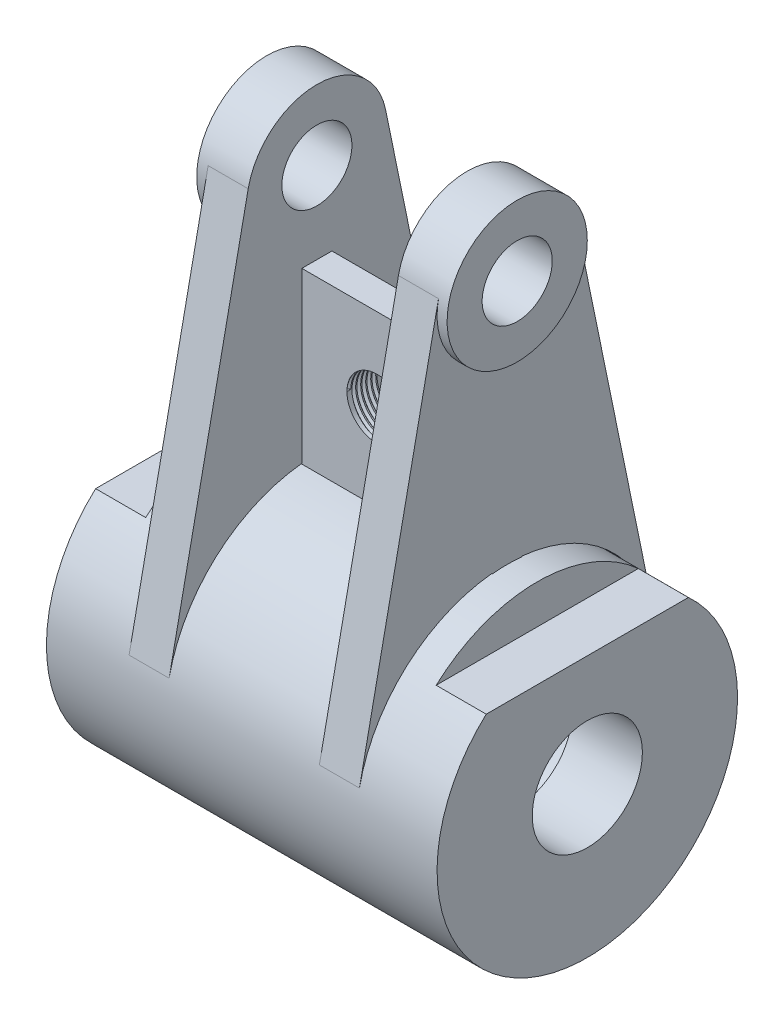
from build123d import *

# Parameters (mm, degrees)
SKETCH1_R               = 30
BOSS_EXTRUDE1_DEPTH     = 39
CUT_EXTRUDE1_DEPTH      = 10
SKETCH3_R               = 18
CUT_EXTRUDE2_DEPTH      = 25
SKETCH4_R               = 11
CUT_EXTRUDE3_DEPTH      = 94
BOSS_EXTRUDE2_START     = -10
BOSS_EXTRUDE2_OUTLINE_R = 7
BOSS_EXTRUDE2_DEPTH     = 10
CUT_EXTRUDE4_DEPTH      = 2
SKETCH6_3_W             = 6
SKETCH6_3_H             = 37.494857384
BOSS_EXTRUDE3_DEPTH     = 32
SKETCH8_R               = 6
CUT_EXTRUDE5_DEPTH      = 41.5
SKETCH16_R              = 8
CUT_EXTRUDE6_DEPTH      = 83
THREAD2_PITCH           = 1


# Read off the part's stored shape, not the designer's step: Boss-Extrude2
with BuildPart() as part:
    # Sketch1 → Boss-Extrude1 (new, symmetric)
    with BuildSketch(Plane(origin=(0, 0, 0), x_dir=(0, 0, -1), z_dir=(1, 0, 0))):
        Circle(SKETCH1_R)
    extrude(amount=BOSS_EXTRUDE1_DEPTH, both=True)

    # Sketch2 → Cut-Extrude1 (cut)
    with BuildSketch(Plane(origin=(39, 0, 0), x_dir=(0, 0, -1), z_dir=(1, 0, 0))):
        with BuildLine():
            Line((-20.182341534, 22.196240452), (0, 22.196240452))
            Line((0, 22.196240452), (20.182341534, 22.196240452))
            ThreePointArc((20.182341534, 22.196240452), (0, 30), (-20.182341534, 22.196240452))
        make_face()
    cut_extrude1 = extrude(amount=-CUT_EXTRUDE1_DEPTH, mode=Mode.SUBTRACT)

    # Mirror2: Cut-Extrude1 across plane
    add(cut_extrude1.mirror(Plane(origin=(0, 0, 0), x_dir=(0, 0, 1), z_dir=(1, 0, 0))), mode=Mode.SUBTRACT)

    # Sketch3 → Cut-Extrude2 (cut, symmetric)
    with BuildSketch(Plane(origin=(0, 0, 0), x_dir=(0, 0, -1), z_dir=(1, 0, 0))):
        Circle(SKETCH3_R)
    extrude(amount=CUT_EXTRUDE2_DEPTH, both=True, mode=Mode.SUBTRACT)

    # Sketch4 → Cut-Extrude3 (cut, symmetric)
    with BuildSketch(Plane(origin=(39, 0, 0), x_dir=(0, 0, -1), z_dir=(1, 0, 0))):
        Circle(SKETCH4_R)
    extrude(amount=CUT_EXTRUDE3_DEPTH, both=True, mode=Mode.SUBTRACT)

    # Boss-Extrude2 outline → Boss-Extrude2 (add)
    with BuildSketch(Plane(origin=(-15, 0, 0), x_dir=(0, 0, -1), z_dir=(1, 0, 0)).offset(BOSS_EXTRUDE2_START)):
        with BuildLine():
            Line((3, 29.849623113), (3, 29.968207601))
            ThreePointArc((3, 29.968207601), (20.171104868, 22.365598476), (29.500383119, 6.068019663))
            Line((29.500383119, 6.068019663), (13.712911473, 82.820648672))
            ThreePointArc((13.712911473, 82.820648672), (0, 94), (-13.712911473, 82.820648672))
            Line((-13.712911473, 82.820648672), (-29.500383119, 6.068019663))
            ThreePointArc((-29.500383119, 6.068019663), (-20.171104868, 22.365598476), (-3, 29.968207601))
            Line((-3, 29.968207601), (-3, 29.849623113))
            ThreePointArc((-3, 29.849623113), (0, 30), (3, 29.849623113))
        make_face()
        with Locations((0, 80)):
            Circle(BOSS_EXTRUDE2_OUTLINE_R, mode=Mode.SUBTRACT)
    boss_extrude2 = extrude(amount=BOSS_EXTRUDE2_DEPTH)

    # Sketch7 → Cut-Extrude4 (cut)
    with BuildSketch(Plane.ZY.offset(25)):
        with BuildLine():
            ThreePointArc((-29.500383119, 6.068019663), (-20.171104868, 22.365598476), (-3, 29.968207601))
            Line((-3, 29.968207601), (-3, 29.849623113))
            ThreePointArc((-3, 29.849623113), (0, 30), (3, 29.849623113))
            Line((3, 29.849623113), (3, 29.968207601))
            ThreePointArc((3, 29.968207601), (20.171104868, 22.365598476), (29.500383119, 6.068019663))
            Line((29.500383119, 6.068019663), (13.712911473, 82.820648672))
            ThreePointArc((13.712911473, 82.820648672), (13.928042946, 81.417610556), (14, 80))
            ThreePointArc((14, 80), (-1.417610556, 66.071957054), (-13.712911473, 82.820648672))
            Line((-13.712911473, 82.820648672), (-29.500383119, 6.068019663))
        make_face()
    cut_extrude4 = extrude(amount=-CUT_EXTRUDE4_DEPTH, mode=Mode.SUBTRACT)

    # Mirror3: Boss-Extrude2, Cut-Extrude4 across plane
    add(boss_extrude2.mirror(Plane(origin=(0, 0, 0), x_dir=(0, 0, 1), z_dir=(1, 0, 0))))
    add(cut_extrude4.mirror(Plane(origin=(0, 0, 0), x_dir=(0, 0, 1), z_dir=(1, 0, 0))), mode=Mode.SUBTRACT)

    # Sketch6<3> → Boss-Extrude3 (add)
    with BuildSketch(Plane(origin=(-15, 0, 0), x_dir=(0, 0, -1), z_dir=(1, 0, 0))):
        with Locations((0, 44.952571308)):
            Rectangle(SKETCH6_3_W, SKETCH6_3_H)
    extrude(amount=BOSS_EXTRUDE3_DEPTH)

    # Sketch8 → Cut-Extrude5 (cut, symmetric)
    with BuildSketch(Plane(origin=(0, 0, -3), x_dir=(-1, 0, 0), z_dir=(0, 0, -1))):
        with Locations(Location((0, 46.89944487, 0), (0, 0, 180))):
            Circle(SKETCH8_R)
    extrude(amount=CUT_EXTRUDE5_DEPTH, both=True, mode=Mode.SUBTRACT)

    # Sketch16 → Cut-Extrude6 (cut)
    with BuildSketch(Plane(origin=(0, 0, 0), x_dir=(1, 0, 0), z_dir=(0, 1, 0))):
        with Locations(Location((0, 0, 0), (0, 0, 270))):
            Circle(SKETCH16_R)
    extrude(amount=-CUT_EXTRUDE6_DEPTH, mode=Mode.SUBTRACT)

    # Thread2: the profile of Thread Profile2 profile screwed along a right-hand helix of 10 turns, 8 arcs to a turn; built about Z, then put on its axis
    thread2_z = Axis((0, 0, 0), (0, 0, 1))
    thread2_corners = [(5.9997, 0, -0.000173205), (6.541265875, 0, 0.312499999), (6.541265875, 0, 0.437499999), (5.9997, 0, 0.750173202)]
    with BuildLine(mode=Mode.PRIVATE) as thread2_profile:
        Line(thread2_corners[0], thread2_corners[1])
        Line(thread2_corners[1], thread2_corners[2])
        Line(thread2_corners[2], thread2_corners[3])
        Line(thread2_corners[3], thread2_corners[0])
    thread2_cap = Face(thread2_profile.wire())
    thread2_turn_angles = [0, 22.5, 45, 67.5, 90, 112.5, 135, 157.5, 180, 202.5, 225, 247.5, 270, 292.5, 315, 337.5, 360]
    thread2_turn_weights = [1, 0.9238795325112867, 1, 0.9238795325112867, 1, 0.9238795325112867, 1, 0.9238795325112867, 1, 0.9238795325112867, 1, 0.9238795325112867, 1, 0.9238795325112867, 1, 0.9238795325112867, 1]
    thread2_turn_rails = [Edge.make_bspline([Vector(p[0], p[1], 0).rotate(thread2_z, thread2_turn_angles[k]) / thread2_turn_weights[k] + Vector(0, 0, p[2] + THREAD2_PITCH * thread2_turn_angles[k] / 360) for k in range(17)], [0, 0, 0, 1, 1, 2, 2, 3, 3, 4, 4, 5, 5, 6, 6, 7, 7, 8, 8, 8], 2, thread2_turn_weights) for p in thread2_corners]
    thread2_turn_sides = [Face.make_surface_from_curves(thread2_turn_rails[p[0]], thread2_turn_rails[p[1]]) for p in [(0, 1), (1, 2), (2, 3), (3, 0)]]
    thread2 = Plane(origin=(0, 46.89944487, 3), x_dir=(-1, 0, 0), z_dir=(0, 0, -1)) * Solid(Shell([*[p.moved(Location((0, 0, THREAD2_PITCH * i))) for i in range(10) for p in thread2_turn_sides], thread2_cap, thread2_cap.rotate(thread2_z, 3600).moved(Location((0, 0, THREAD2_PITCH * 3600 / 360)))]))
    add(thread2, mode=Mode.SUBTRACT)


solid = part.part
